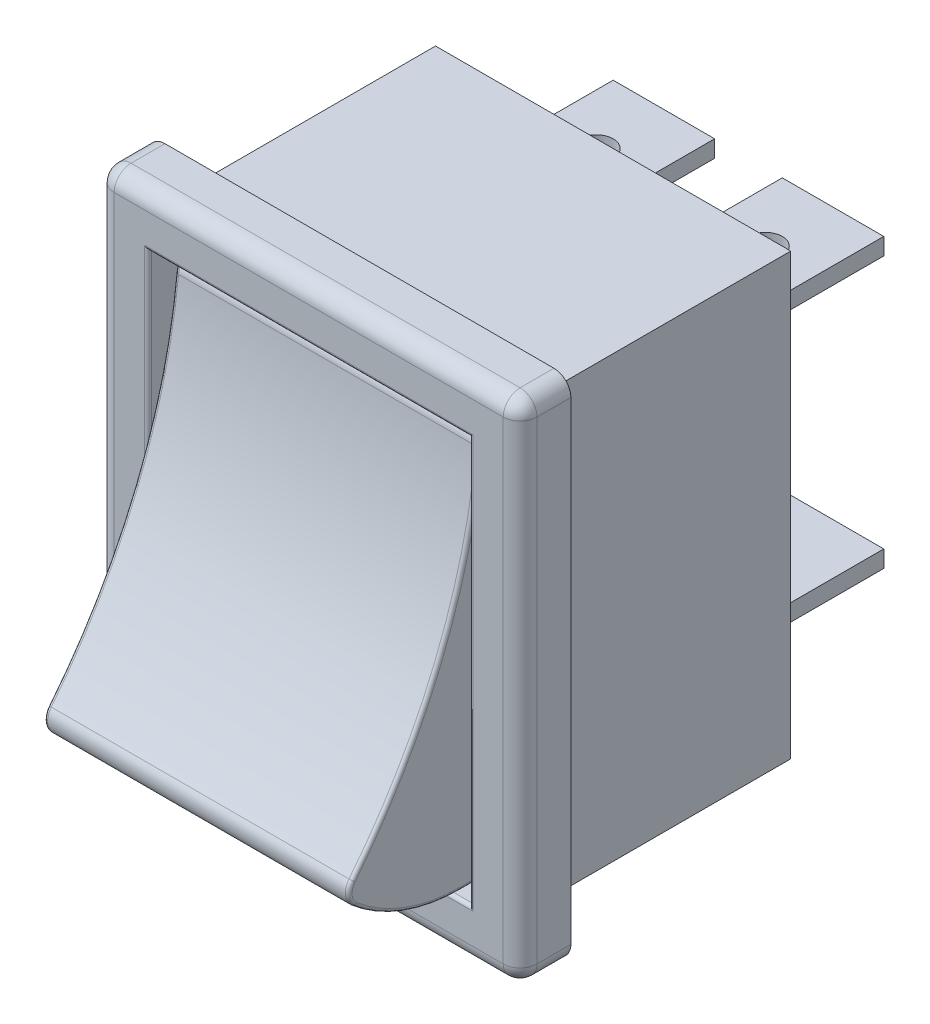
from build123d import *

# Parameters (mm, degrees)
ESQUISSE1_W             = 25
ESQUISSE1_H             = 30
BOSS_EXTRU_1_DEPTH      = 3
ESQUISSE2_W             = 21
ESQUISSE2_H             = 26
BOSS_EXTRU_2_DEPTH      = 15
CONG_1_R                = 1
CONG_2_R                = 1
ESQUISSE3_W             = 19
ESQUISSE3_H             = 24
ENL_V_MAT_EXTRU_1_DEPTH = 2
CONG_3_R                = 0.2
BOSS_EXTRU_4_DEPTH      = 9
CONG_6_R                = 1
CONG_7_R                = 0.2
ESQUISSE6_W             = 6
ESQUISSE6_H             = 1
BOSS_EXTRU_5_DEPTH      = 8
ESQUISSE7_R             = 1
ENL_V_MAT_EXTRU_2_DEPTH = 36.178118199


with BuildPart() as part:
    # Esquisse1 → Boss.-Extru.1 (new body)
    with BuildSketch(Plane.XY):
        Rectangle(ESQUISSE1_W, ESQUISSE1_H)
    extrude(amount=BOSS_EXTRU_1_DEPTH)

    # Esquisse2 → Boss.-Extru.2 (add)
    with BuildSketch(Plane(origin=(0, 0, 0), x_dir=(-1, 0, 0), z_dir=(0, 0, -1))):
        Rectangle(ESQUISSE2_W, ESQUISSE2_H)
    extrude(amount=BOSS_EXTRU_2_DEPTH)

    # Congé1
    cong_1_edges = [part.edges().sort_by_distance(p)[0] for p in [
        (12.5, 0, 3),
        (0, 15, 3),
        (-12.5, 0, 3),
        (0, -15, 3),
    ]]
    fillet(cong_1_edges, radius=CONG_1_R)

    # Congé2
    # the kernel refuses this fillet: 1 mm, written as the material it takes off along each edge
    with BuildSketch(Plane(origin=(11.5, -14, 2), x_dir=(1, 0, 0), z_dir=(0, -1, 0))) as cong_2_piece_1_section:
        Polygon((0, 0), (CONG_2_R, 0), (CONG_2_R, CONG_2_R), (0, CONG_2_R), align=None)
    cong_2_piece_1 = extrude(amount=CONG_2_R, mode=Mode.PRIVATE)
    cong_2_piece_1 = cong_2_piece_1 - Plane(origin=(11.5, -14, 2), x_dir=(-0.7071067811865475, 0, -0.7071067811865475), z_dir=(0, -1, 0)) * Sphere(CONG_2_R, mode=Mode.PRIVATE)
    add(cong_2_piece_1, mode=Mode.SUBTRACT)
    with BuildSketch(Plane(origin=(-11.5, -14, 2), x_dir=(-1, 0, 0), z_dir=(0, -1, 0))) as cong_2_piece_2_section:
        Polygon((0, 0), (CONG_2_R, 0), (CONG_2_R, -CONG_2_R), (0, -CONG_2_R), align=None)
    cong_2_piece_2 = extrude(amount=CONG_2_R, mode=Mode.PRIVATE)
    cong_2_piece_2 = cong_2_piece_2 - Plane(origin=(-11.5, -14, 2), x_dir=(0.7071067811865475, 0, -0.7071067811865475), z_dir=(0, -1, 0)) * Sphere(CONG_2_R, mode=Mode.PRIVATE)
    add(cong_2_piece_2, mode=Mode.SUBTRACT)
    with BuildSketch(Plane(origin=(11.5, 14, 2), x_dir=(0, 1, 0), z_dir=(1, 0, 0))) as cong_2_piece_3_section:
        Polygon((0, 0), (CONG_2_R, 0), (CONG_2_R, CONG_2_R), (0, CONG_2_R), align=None)
    cong_2_piece_3 = extrude(amount=CONG_2_R, mode=Mode.PRIVATE)
    cong_2_piece_3 = cong_2_piece_3 - Plane(origin=(11.5, 14, 2), x_dir=(0, -0.7071067811865475, -0.7071067811865475), z_dir=(1, 0, 0)) * Sphere(CONG_2_R, mode=Mode.PRIVATE)
    add(cong_2_piece_3, mode=Mode.SUBTRACT)
    with BuildSketch(Plane(origin=(-11.5, 14, 2), x_dir=(0, 1, 0), z_dir=(-1, 0, 0))) as cong_2_piece_4_section:
        Polygon((0, 0), (CONG_2_R, 0), (CONG_2_R, -CONG_2_R), (0, -CONG_2_R), align=None)
    cong_2_piece_4 = extrude(amount=CONG_2_R, mode=Mode.PRIVATE)
    cong_2_piece_4 = cong_2_piece_4 - Plane(origin=(-11.5, 14, 2), x_dir=(0, -0.7071067811865475, -0.7071067811865475), z_dir=(-1, 0, 0)) * Sphere(CONG_2_R, mode=Mode.PRIVATE)
    add(cong_2_piece_4, mode=Mode.SUBTRACT)
    with BuildSketch(Plane(origin=(-12.5, 15, -2.5), x_dir=(0, -1, 0), z_dir=(0, 0, 1)), Plane(origin=(-12.5, -15, -2.5), x_dir=(1, 0, 0), z_dir=(0, 0, 1))) as cong_2_piece_5:
        with BuildLine():
            CenterArc((CONG_2_R, CONG_2_R), CONG_2_R, 180, 90)
            Line((0, CONG_2_R), (0, 0))
            Line((0, 0), (CONG_2_R, 0))
        make_face()
    extrude(amount=4.5, mode=Mode.SUBTRACT)
    with BuildSketch(Plane(origin=(12.5, 15, -2.5), x_dir=(0, -1, 0), z_dir=(0, 0, 1)), Plane(origin=(12.5, -15, -2.5), x_dir=(-1, 0, 0), z_dir=(0, 0, 1))) as cong_2_piece_6:
        with BuildLine():
            CenterArc((CONG_2_R, -CONG_2_R), CONG_2_R, 90, 90)
            Line((0, -CONG_2_R), (0, 0))
            Line((0, 0), (CONG_2_R, 0))
        make_face()
    extrude(amount=4.5, mode=Mode.SUBTRACT)

    # Esquisse3 → Enlèv. mat.-Extru.1 (cut)
    with BuildSketch(Plane.XY.offset(3)):
        Rectangle(ESQUISSE3_W, ESQUISSE3_H)
    extrude(amount=-ENL_V_MAT_EXTRU_1_DEPTH, mode=Mode.SUBTRACT)

    # Congé3
    cong_3_edges = [part.edges().sort_by_distance(p)[0] for p in [
        (0, -12, 3),
        (9.5, 0, 3),
        (0, 12, 3),
        (-9.5, 0, 3),
    ]]
    fillet(cong_3_edges, radius=CONG_3_R)

    # Esquisse6 → Boss.-Extru.5 (add)
    with BuildSketch(Plane(origin=(0, 0, -15), x_dir=(-1, 0, 0), z_dir=(0, 0, -1))):
        with Locations((-5, 8)):
            Rectangle(ESQUISSE6_W, ESQUISSE6_H)
        with Locations((5, 8)):
            Rectangle(ESQUISSE6_W, ESQUISSE6_H)
        with Locations((5, -8)):
            Rectangle(ESQUISSE6_W, ESQUISSE6_H)
        with Locations((-5, -8)):
            Rectangle(ESQUISSE6_W, ESQUISSE6_H)
    extrude(amount=BOSS_EXTRU_5_DEPTH)

    # Esquisse7 → Enlèv. mat.-Extru.2 (cut, through all)
    with BuildSketch(Plane(origin=(0, 8.5, 0), x_dir=(1, 0, 0), z_dir=(0, 1, 0))):
        with Locations(Location((5, 19, 0), (0, 0, 270))):
            Circle(ESQUISSE7_R)
        with Locations(Location((-5, 19, 0), (0, 0, 270))):
            Circle(ESQUISSE7_R)
    extrude(amount=-ENL_V_MAT_EXTRU_2_DEPTH, mode=Mode.SUBTRACT)


with BuildPart() as body_2:
    # Esquisse5 → Boss.-Extru.4 (new, symmetric)
    with BuildSketch(Plane(origin=(0, 0, 0), x_dir=(0, 0, -1), z_dir=(1, 0, 0))):
        with BuildLine():
            Line((-1, 11.5), (-1.81585961, 11.5))
            ThreePointArc((-1.81585961, 11.5), (-4.325737909, 0.85255597), (-10, -8.5))
            ThreePointArc((-10, -8.5), (-6.807886553, -10.718401957), (-3, -11.5))
            Line((-3, -11.5), (-1, -11.5))
            Line((-1, -11.5), (-1, 11.5))
        make_face()
    extrude(amount=BOSS_EXTRU_4_DEPTH, both=True)

    # Congé6
    # the kernel refuses this fillet: 1 mm, written as the material it takes off along each edge
    with BuildSketch(Plane(origin=(-11.245669282, 11.5, 1.81585961), x_dir=(0, 0, -1), z_dir=(1, 0, 0))) as cong_6_piece_1:
        with BuildLine():
            CenterArc((0.916558206, -0.994916978), CONG_6_R, 95.779400144, 78.476879522)
            Line((-0.078421287, -0.894837966), (-0.098320877, -0.892836386))
            ThreePointArc((-0.098320877, -0.892836386), (-0.056263433, -0.445924521), (-0.019944402, 0.001490244))
            Line((-0.019944402, 0.001490244), (0, 0.02))
            ThreePointArc((0, 0.02), (0.407929805, 0.02), (0.813845638, 0.01989834))
            Line((0.813845638, 0.01989834), (0.81585961, 0))
        make_face()
    extrude(amount=22.491338564, mode=Mode.SUBTRACT)
    with BuildSketch(Plane(origin=(-11.458601046, -8.5, 10), x_dir=(0, -0.6881193570157783, -0.7255975127439398), z_dir=(1, 0, 0))) as cong_6_piece_2:
        with BuildLine():
            CenterArc((0.93257281, 0.998705405), CONG_6_R, 184.74826644, 88.167491153)
            Line((-0.063995197, 0.91592735), (-0.083926557, 0.914271789))
            ThreePointArc((-0.083926557, 0.914271789), (-0.048945373, 0.456779546), (-0.019967929, -0.001132174))
            Line((-0.019967929, -0.001132174), (-0.001017352, -0.019974108))
            ThreePointArc((-0.001017352, -0.019974108), (0.491720209, -0.032514416), (0.98445777, -0.019974108))
            Line((0.98445777, -0.019974108), (0.983440418, 0))
        make_face()
    extrude(amount=22.917202091, mode=Mode.SUBTRACT)

    # Congé7
    cong_7_edges = [body_2.edges().sort_by_distance(p)[0] for p in [
        (9, -10.900597474, 6.350994697),
        (-9, 0.861762657, 4.321971995),
        (9, 0.861762657, 4.321971995),
        (-9, -8.510312958, 9.63174172),
        (-9, 11.211969601, 1.606628319),
        (9, -8.510312958, 9.63174172),
        (9, 11.211969601, 1.606628319),
        (9, -11.5, 2),
        (-9, -10.900597474, 6.350994697),
        (-9, 0, 1),
        (-9, -11.5, 2),
        (9, 0, 1),
    ]]
    fillet(cong_7_edges, radius=CONG_7_R)


solid = Compound([part.part, body_2.part])
